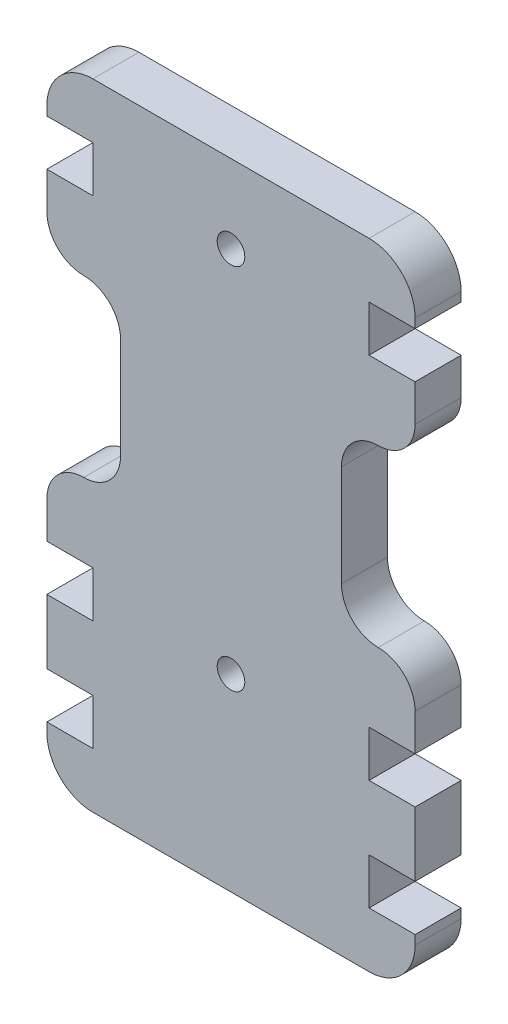
from build123d import *

# Parameters (mm, degrees)
ESQUISSE1_R        = 1.5
BOSS_EXTRU_1_DEPTH = 5
CONG_1_R           = 5
CONG_3_START       = -1
CONG_3_DEPTH       = 7
CONG_3_2_DEPTH     = 5


with BuildPart() as part:
    # Esquisse1 → Boss.-Extru.1 (new body)
    with BuildSketch(Plane.XY):
        Polygon((20, 0), (20, 7), (15, 7), (15, 12), (20, 12), (20, 20), (12, 20), (12, 39), (20, 39), (20, 47), (15, 47), (15, 52), (20, 52), (20, 58), (-20, 58), (-20, 52), (-15, 52), (-15, 47), (-20, 47), (-20, 39), (-12, 39), (-12, 20), (-20, 20), (-20, 12), (-15, 12), (-15, 7), (-20, 7), (-20, 0), (-15, 0), (-15, -5), (-20, -5), (-20, -11), (20, -11), (20, -5), (15, -5), (15, 0), align=None)
        with Locations((0, 49.5)):
            Circle(ESQUISSE1_R, mode=Mode.SUBTRACT)
        with Locations((0, 9.5)):
            Circle(ESQUISSE1_R, mode=Mode.SUBTRACT)
    extrude(amount=BOSS_EXTRU_1_DEPTH)

    # Congé1
    cong_1_edges = [part.edges().sort_by_distance(p)[0] for p in [
        (-20, 58, 2.5),
        (20, 58, 2.5),
        (20, -11, 2.5),
        (-20, -11, 2.5),
    ]]
    fillet(cong_1_edges, radius=CONG_1_R)

    # Congé3: read off the stored shape, not the designer's step
    # Congé3 outline → Congé3 (cut)
    with BuildSketch(Plane.XY.offset(CONG_3_START)):
        with BuildLine():
            Line((20, 20), (16, 20))
            ThreePointArc((16, 20), (18.828427125, 18.828427125), (20, 16))
            Line((20, 16), (20, 20))
        make_face()
        with BuildLine():
            ThreePointArc((20, 43), (18.828427125, 40.171572875), (16, 39))
            Line((16, 39), (20, 39))
            Line((20, 39), (20, 43))
        make_face()
        with BuildLine():
            Line((-20, 39), (-16, 39))
            ThreePointArc((-16, 39), (-18.828427125, 40.171572875), (-20, 43))
            Line((-20, 43), (-20, 39))
        make_face()
        with BuildLine():
            ThreePointArc((-20, 16), (-18.828427125, 18.828427125), (-16, 20))
            Line((-16, 20), (-20, 20))
            Line((-20, 20), (-20, 16))
        make_face()
    extrude(amount=CONG_3_DEPTH, mode=Mode.SUBTRACT)

    # Cong_3 2 outline → Cong_3 2 (add)
    with BuildSketch(Plane.XY):
        with BuildLine():
            Line((12, 39), (12, 35))
            ThreePointArc((12, 35), (13.171572875, 37.828427125), (16, 39))
            Line((16, 39), (12, 39))
        make_face()
        with BuildLine():
            ThreePointArc((16, 20), (13.171572875, 21.171572875), (12, 24))
            Line((12, 24), (12, 20))
            Line((12, 20), (16, 20))
        make_face()
        with BuildLine():
            ThreePointArc((-16, 39), (-13.171572875, 37.828427125), (-12, 35))
            Line((-12, 35), (-12, 39))
            Line((-12, 39), (-16, 39))
        make_face()
        with BuildLine():
            ThreePointArc((-12, 24), (-13.171572875, 21.171572875), (-16, 20))
            Line((-16, 20), (-12, 20))
            Line((-12, 20), (-12, 24))
        make_face()
    extrude(amount=CONG_3_2_DEPTH)


solid = part.part
